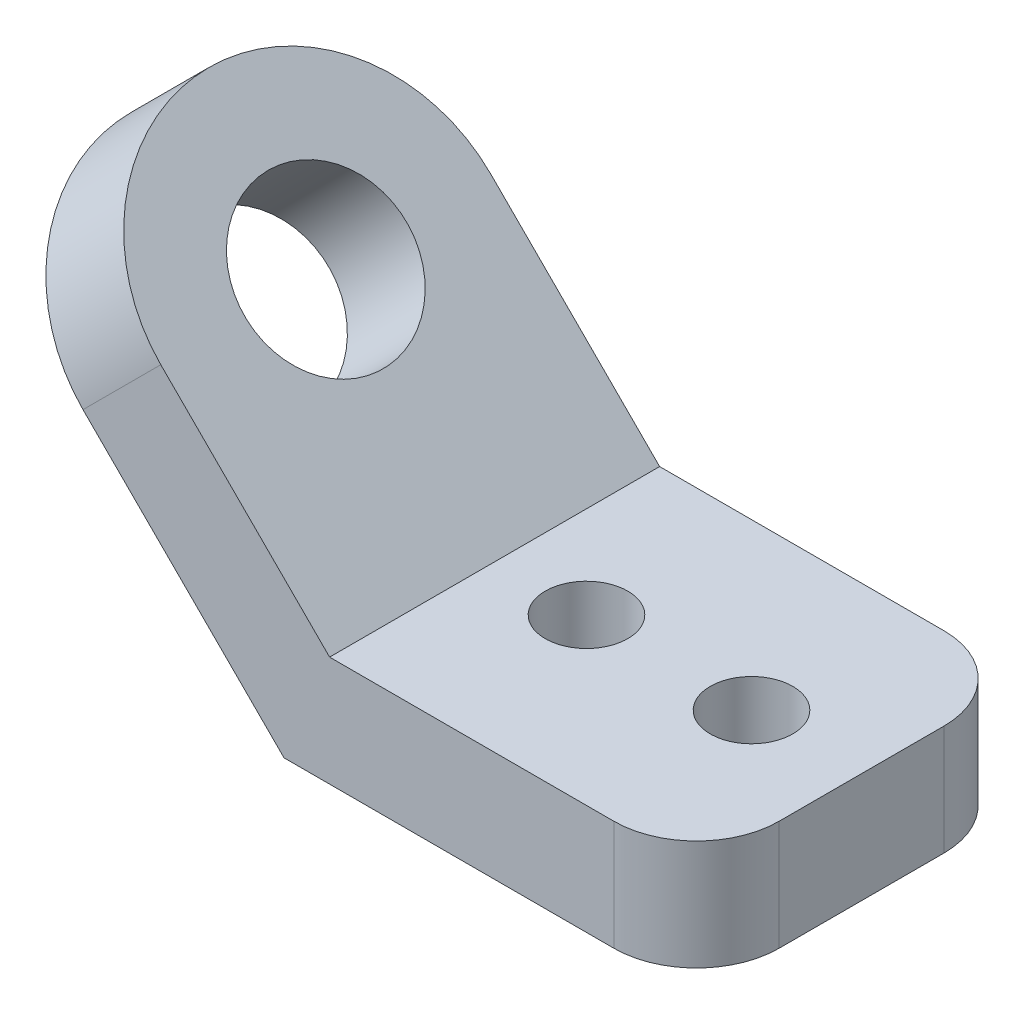
from build123d import *

# Parameters (mm, degrees)
SALIENTE_EXTRUIR1_DEPTH = 3
REDONDEO1_R             = 3
REDONDEO2_R             = 1.5
CROQUIS3_R              = 1.475
CORTAR_EXTRUIR1_DEPTH   = 15.812114009
CROQUIS4_R              = 0.75
CORTAR_EXTRUIR2_DEPTH   = 15.565263254


with BuildPart() as part:
    # Croquis1 → Saliente-Extruir1 (new, symmetric)
    with BuildSketch(Plane.XY):
        Polygon((0, 0), (-7.498427125, 0), (-13.274377336, 5.775950212), (-11.860163774, 7.190163774), (-6.67, 2), (0, 2), align=None)
    extrude(amount=SALIENTE_EXTRUIR1_DEPTH, both=True)

    # Redondeo1
    redondeo1_edges = [part.edges().sort_by_distance(p)[0] for p in [
        (-12.567270555, 6.483056993, -3),
        (-12.567270555, 6.483056993, 3),
    ]]
    fillet(redondeo1_edges, radius=REDONDEO1_R - 0.0001)  # a hair under: the kernel refuses the full size

    # Redondeo2
    redondeo2_edges = [part.edges().sort_by_distance(p)[0] for p in [
        (0, 1, 3),
        (0, 1, -3),
    ]]
    fillet(redondeo2_edges, radius=REDONDEO2_R)

    # Croquis3 → Cortar-Extruir1 (cut, through all)
    with BuildSketch(Plane(origin=(-2.335, -2.335, 0), x_dir=(0, 0, -1), z_dir=(0.7071067811865485, 0.7071067811865466, 0))):
        with Locations(Location((0, 10.470615793, 0), (0, 0, 90))):
            Circle(CROQUIS3_R)
    extrude(amount=-CORTAR_EXTRUIR1_DEPTH, mode=Mode.SUBTRACT)

    # Croquis4 → Cortar-Extruir2 (cut, through all)
    with BuildSketch(Plane(origin=(0, 2, 0), x_dir=(1, 0, 0), z_dir=(0, 1, 0))):
        with Locations(Location((-5, 0, 0), (0, 0, 180))):
            Circle(CROQUIS4_R)
        with Locations(Location((-2, 0, 0), (0, 0, 180))):
            Circle(CROQUIS4_R)
    extrude(amount=-CORTAR_EXTRUIR2_DEPTH, mode=Mode.SUBTRACT)


solid = part.part
